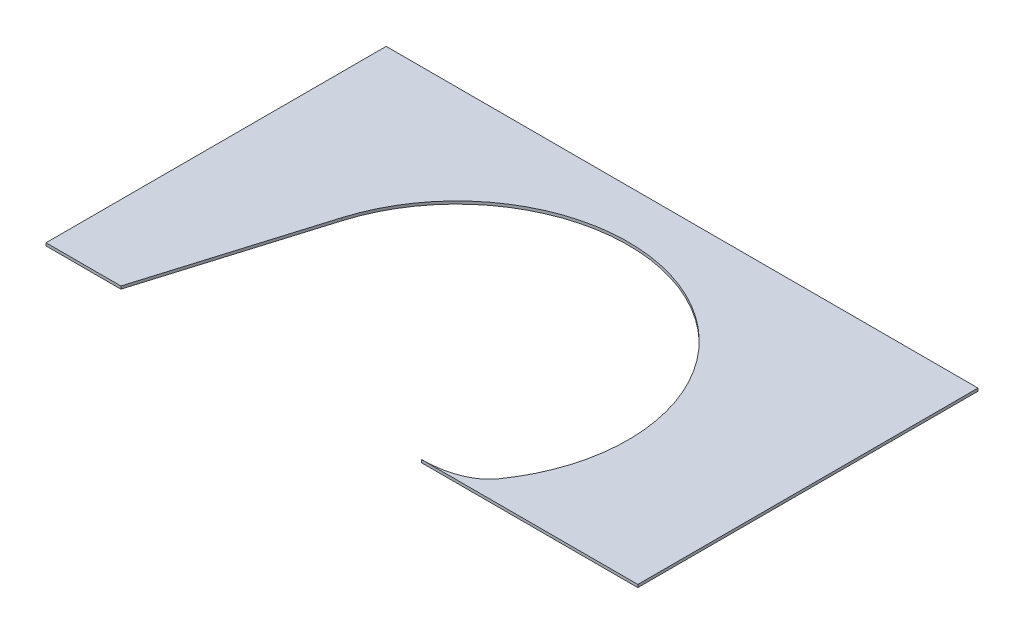
from build123d import *

# Parameters (mm, degrees)
SKETCH1_W           = 679.45
SKETCH1_H           = 390.525
BOSS_EXTRUDE1_DEPTH = 3.175
CUT_EXTRUDE1_DEPTH  = 784.691367025


with BuildPart() as part:
    # Sketch1 → Boss-Extrude1 (new body)
    with BuildSketch(Plane(origin=(0, 0, 0), x_dir=(1, 0, 0), z_dir=(0, 1, 0))):
        with Locations((339.725, 195.2625)):
            Rectangle(SKETCH1_W, SKETCH1_H)
    extrude(amount=BOSS_EXTRUDE1_DEPTH)

    # Sketch2 → Cut-Extrude1 (cut, through all)
    with BuildSketch(Plane(origin=(0, 3.175, 0), x_dir=(1, 0, 0), z_dir=(0, 1, 0))):
        with BuildLine():
            Line((85.969595214, 0), (144.94310832, 195.125870822))
            ThreePointArc((144.94310832, 195.125870822), (213.496688948, 294.313622014), (327.025, 334.923054329))
            ThreePointArc((327.025, 334.923054329), (472.568969877, 277.369470219), (530.122553987, 131.825500342))
            ThreePointArc((530.122553987, 131.825500342), (520.134888885, 75.960820373), (494.625079918, 25.266978846))
            add(Edge.make_bspline(
                [(494.625079918, 25.266978846), (493.45726691, 23.599169027), (490.895198527, 20.455459241), (484.77915912, 14.749916444), (475.335730084, 8.752143258), (461.521693133, 3.539448625), (446.52585596, 0.60585218), (436.14905366, 0), (431.240409941, 0)],
                knots=[0, 0, 0, 0, 0.027722316, 0.055444633, 0.110889265, 0.166333898, 0.22177853, 0.270938409, 0.270938409, 0.270938409, 0.270938409], degree=3))
            Line((431.240409941, 0), (85.969595214, 0))
        make_face()
    extrude(amount=-CUT_EXTRUDE1_DEPTH, mode=Mode.SUBTRACT)


solid = part.part
